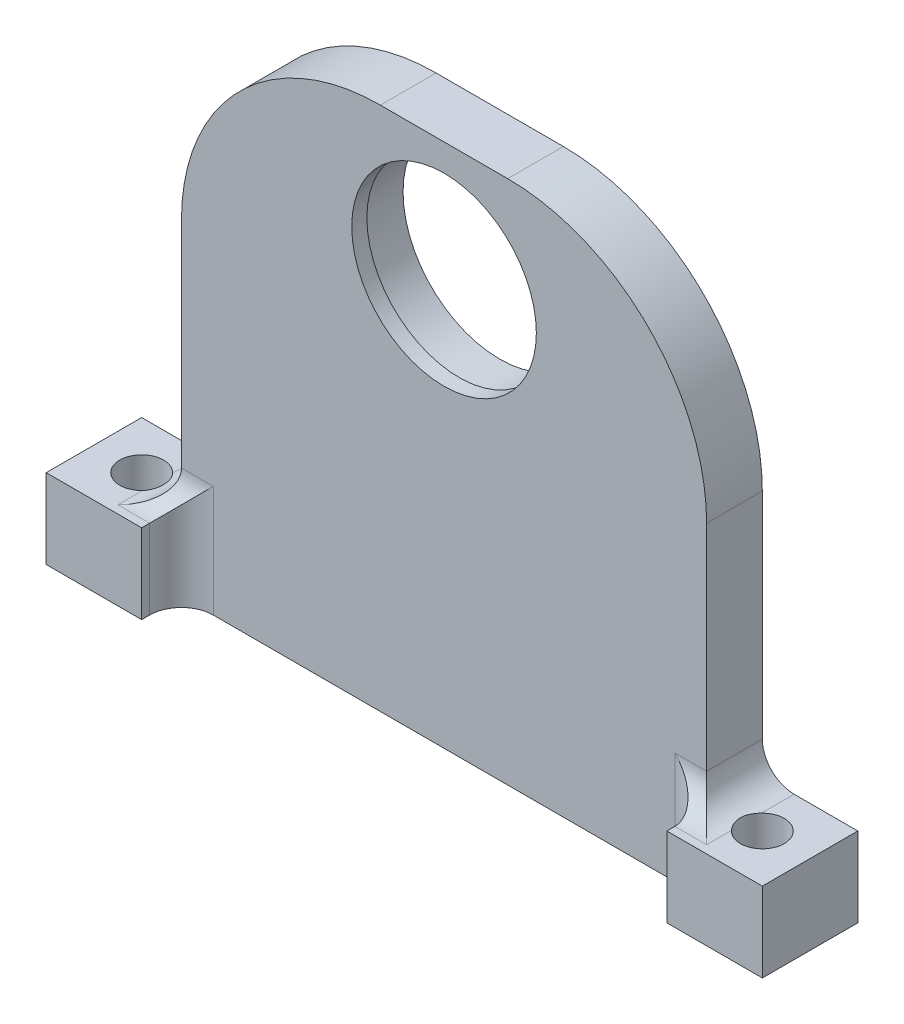
from build123d import *
from build123d.topology import SkipClean

# Parameters (mm, degrees)
BOSS_EXTRUDE1_DEPTH = 7
SKETCH2_W           = 12
SKETCH2_H           = 10
BOSS_EXTRUDE2_DEPTH = 12
FILLET1_R           = 4
FILLET2_R           = 4
SKETCH3_R           = 2.75
CUT_EXTRUDE1_DEPTH  = 81.777472107
SKETCH4_R           = 12.15
CUT_EXTRUDE2_DEPTH  = 5.1
FILLET3_R           = 25


with BuildPart() as part:
    # Sketch1 → Boss-Extrude1 (new body)
    with BuildSketch(Plane.XY):
        with BuildLine():
            Line((0, 15), (33, 15))
            Line((33, 15), (33, -51))
            Line((33, -51), (0, -51))
            Line((0, -51), (0, -11.6))
            ThreePointArc((0, -11.6), (11.6, 0), (0, 11.6))
            Line((0, 11.6), (0, 15))
        make_face()
    extrude(amount=BOSS_EXTRUDE1_DEPTH)

    # Sketch2 → Boss-Extrude2 (add)
    with BuildSketch(Plane(origin=(0, 0, 0), x_dir=(-1, 0, 0), z_dir=(0, 0, -1))):
        with Locations((-39, -46)):
            Rectangle(SKETCH2_W, SKETCH2_H)
    extrude(amount=-BOSS_EXTRUDE2_DEPTH)

    # Fillet1
    fillet1_edges = [part.edges().sort_by_distance(p)[0] for p in [
        (33, -41, 3.5),
    ]]
    fillet(fillet1_edges, radius=FILLET1_R)

    # Fillet2
    fillet2_edges = [part.edges().sort_by_distance(p)[0] for p in [
        (33, -46, 7),
        (35, -41, 7),
    ]]
    fillet(fillet2_edges, radius=FILLET2_R)

    # Sketch3 → Cut-Extrude1 (cut, through all)
    with BuildSketch(Plane(origin=(0, -51, 0), x_dir=(1, 0, 0), z_dir=(0, 1, 0))):
        with Locations((39, -6)):
            Circle(SKETCH3_R)
    extrude(amount=CUT_EXTRUDE1_DEPTH, mode=Mode.SUBTRACT)

    # Sketch4 → Cut-Extrude2 (cut)
    with BuildSketch(Plane(origin=(0, 0, 0), x_dir=(-1, 0, 0), z_dir=(0, 0, -1))):
        Circle(SKETCH4_R)
    extrude(amount=-CUT_EXTRUDE2_DEPTH, mode=Mode.SUBTRACT)

    # Fillet3
    fillet3_edges = [part.edges().sort_by_distance(p)[0] for p in [
        (33, 15, 3.5),
    ]]
    fillet(fillet3_edges, radius=FILLET3_R)

    # Mirror1: part across plane


with BuildPart() as part_1:
    with SkipClean():  # the faces are left unmerged after this step: merging them gives an invalid solid
        add(part.part)
        add(part.part.mirror(Plane(origin=(0, -11.6, 7), x_dir=(0, 0, 1), z_dir=(1, 0, 0))))


solid = part_1.part
